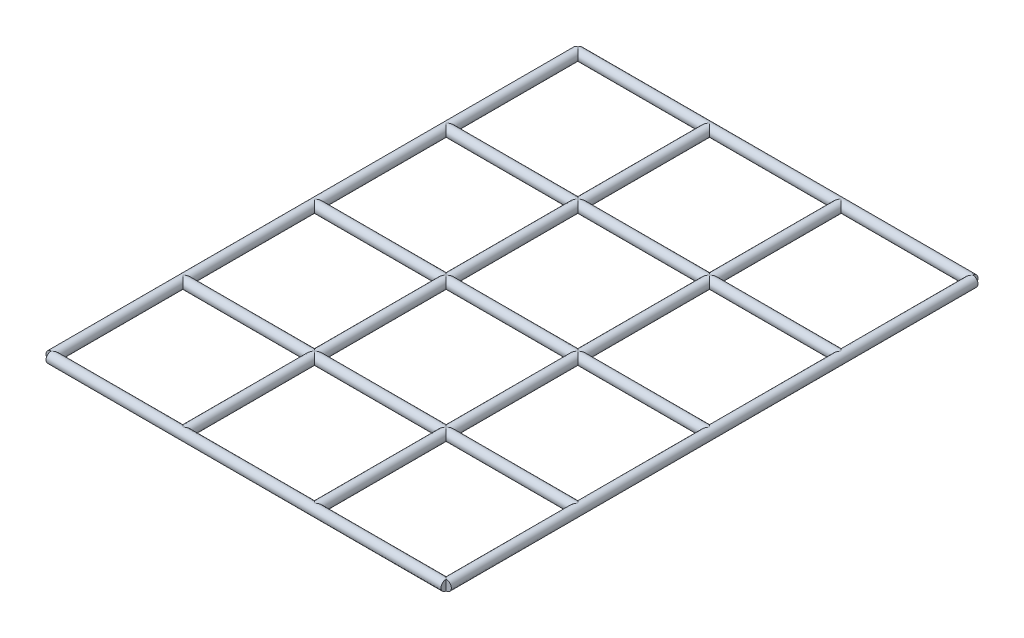
from build123d import *

# Parameters (mm, degrees)
SKETCH1_R           = 1.9812
BASE_EXTRUDE_DEPTH  = 203.2
SKETCH2_R           = 1.9812
BOSS_EXTRUDE1_DEPTH = 152.4
LPATTERN1_START     = -203.2
LPATTERN1_OUTLINE_R = 1.9812
LPATTERN1_DEPTH     = 203.2
LPATTERN2_COUNT     = 5
LPATTERN2_PITCH     = 50.8


# Read off the part's stored shape, not the designer's step: LPattern1
with BuildPart() as part:
    # Sketch1 → Base-Extrude (new body)
    with BuildSketch(Plane.XY):
        Circle(SKETCH1_R)
    extrude(amount=-BASE_EXTRUDE_DEPTH)

    # Sketch2 → Boss-Extrude1 (add)
    with BuildSketch(Plane(origin=(0, 0, 0), x_dir=(0, 0, -1), z_dir=(1, 0, 0))):
        Circle(SKETCH2_R)
    boss_extrude1 = extrude(amount=BOSS_EXTRUDE1_DEPTH)

    # LPattern1 outline → LPattern1 (add)
    with BuildSketch(Plane.XY.offset(LPATTERN1_START)):
        with Locations((50.8, 0)):
            Circle(LPATTERN1_OUTLINE_R)
        with Locations((101.6, 0)):
            Circle(LPATTERN1_OUTLINE_R)
        with Locations((152.4, 0)):
            Circle(LPATTERN1_OUTLINE_R)
    extrude(amount=LPATTERN1_DEPTH)

    # LPattern2: Boss-Extrude1 ×5
    with Locations(*[(0, 0, -i * LPATTERN2_PITCH) for i in range(1, LPATTERN2_COUNT)]):
        add(boss_extrude1)


solid = part.part
